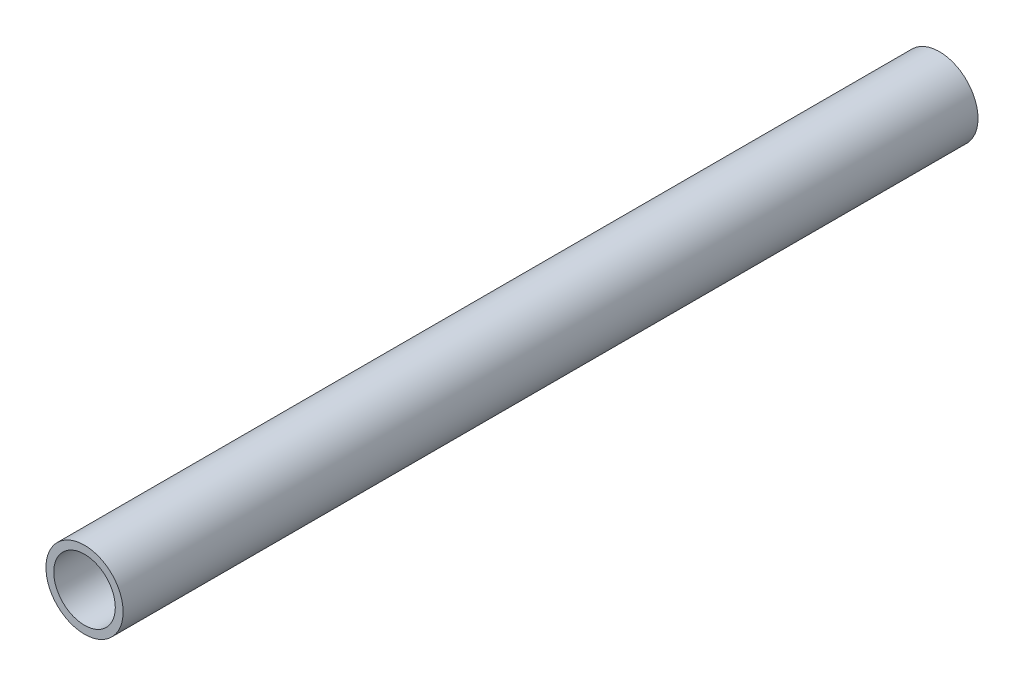
from build123d import *

# Parameters (mm, degrees)
SKETCH1_R           = 16.7005
SKETCH1_R_2         = 13.3223
BOSS_EXTRUDE1_DEPTH = 185


with BuildPart() as part:
    # Sketch1 → Boss-Extrude1 (new, symmetric)
    with BuildSketch(Plane.XY):
        Circle(SKETCH1_R)
        Circle(SKETCH1_R_2, mode=Mode.SUBTRACT)
    extrude(amount=BOSS_EXTRUDE1_DEPTH, both=True)


solid = part.part
